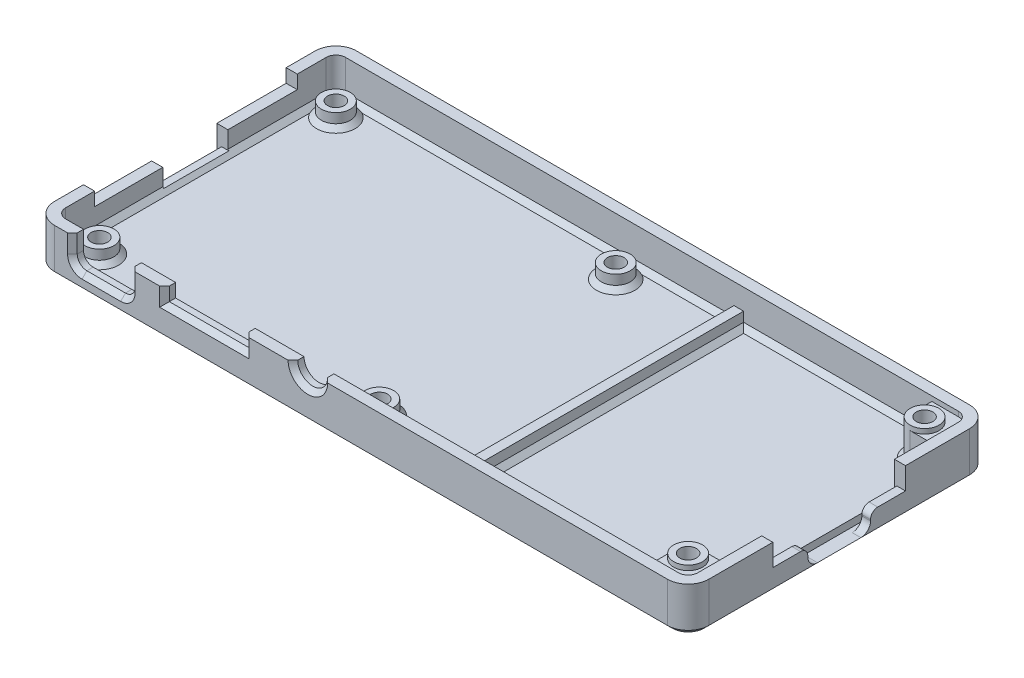
from build123d import *

# Parameters (mm, degrees)
SKETCH3_W                                         = 135.6
SKETCH3_H                                         = 62.6
SKETCH3_W_2                                       = 131
SKETCH3_H_2                                       = 58
BOSS_EXTRUDE1_DEPTH                               = 9.3
SKETCH5_W                                         = 131
SKETCH5_H                                         = 58
BOSS_EXTRUDE2_DEPTH                               = 2
SKETCH6_R                                         = 3
BOSS_EXTRUDE3_DEPTH                               = 3
SKETCH10_W                                        = 2
SKETCH10_H                                        = 58
BOSS_EXTRUDE4_DEPTH                               = 3
CUT_EXTRUDE1_REACH                                = 100.028
SKETCH11_R                                        = 3.1
SKETCH11_W                                        = 12
SKETCH11_H                                        = 5.8
SKETCH11_W_2                                      = 16.5
SKETCH11_H_2                                      = 2.8
CUT_EXTRUDE2_REACH                                = 142.206
SKETCH12_W                                        = 42
SKETCH12_H                                        = 2.8
SKETCH12_W_2                                      = 13.5
SKETCH12_H_2                                      = 3.7
FILLET6_R                                         = 2
FILLET8_R                                         = 2
CHAMFER1_SIZE                                     = 1
BOSS_EXTRUDE7_DEPTH                               = 7.3
FILLET20_R                                        = 4.3
CHAMFER5_SIZE                                     = 1
CSK_FOR_4_FLAT_HEAD_SOCKET_CAP_SCREW1_D           = 3.4544
CSK_FOR_4_FLAT_HEAD_SOCKET_CAP_SCREW1_DEPTH       = 14
CSK_FOR_4_FLAT_HEAD_SOCKET_CAP_SCREW1_CSINK_D     = 6.723761
CSK_FOR_4_FLAT_HEAD_SOCKET_CAP_SCREW1_CSINK_ANGLE = 82
CSK_FOR_4_FLAT_HEAD_SOCKET_CAP_SCREW1_TIP         = 1.037806461
CHAMFER7_SIZE                                     = 1
CHAMFER8_SIZE                                     = 1
CUT_EXTRUDE3_START                                = -1
CUT_EXTRUDE3_DEPTH                                = 1
FILLET21_R                                        = 2
CHAMFER9_SIZE                                     = 1
CUT_EXTRUDE4_DEPTH                                = 0.5
CUT_EXTRUDE4_DEPTH_BACK                           = 0.5
SKETCH30_W                                        = 27.5
SKETCH30_H                                        = 27.5
CUT_EXTRUDE5_DEPTH                                = 139.465527882


with BuildPart() as part:
    # Sketch3 → Boss-Extrude1 (new body)
    with BuildSketch(Plane(origin=(0, 0, 0), x_dir=(1, 0, 0), z_dir=(0, 1, 0))):
        with Locations((-7.061766162, 3.105993834)):
            Rectangle(SKETCH3_W, SKETCH3_H)
        with Locations((-7.061766162, 3.105993834)):
            Rectangle(SKETCH3_W_2, SKETCH3_H_2, mode=Mode.SUBTRACT)
    extrude(amount=BOSS_EXTRUDE1_DEPTH)

    # Sketch5 → Boss-Extrude2 (add)
    with BuildSketch(Plane(origin=(0, 0, 0), x_dir=(1, 0, 0), z_dir=(0, 1, 0))):
        with Locations((-7.061766162, 3.105993834)):
            Rectangle(SKETCH5_W, SKETCH5_H)
    extrude(amount=BOSS_EXTRUDE2_DEPTH)

    # Sketch6 → Boss-Extrude3 (add)
    with BuildSketch(Plane(origin=(0, 2, 0), x_dir=(1, 0, 0), z_dir=(0, 1, 0))):
        with Locations(Location((-68.061766162, 27.605993834, 0), (0, 0, 270))):
            Circle(SKETCH6_R)
        with Locations(Location((-68.061766162, -21.394006166, 0), (0, 0, 270))):
            Circle(SKETCH6_R)
        with Locations(Location((-10.061766162, -21.394006166, 0), (0, 0, 270))):
            Circle(SKETCH6_R)
        with Locations(Location((-10.061766162, 27.605993834, 0), (0, 0, 270))):
            Circle(SKETCH6_R)
    extrude(amount=BOSS_EXTRUDE3_DEPTH)

    # Sketch10 → Boss-Extrude4 (add)
    with BuildSketch(Plane(origin=(0, 2, 0), x_dir=(1, 0, 0), z_dir=(0, 1, 0))):
        with Locations((10.938233838, 3.105993834)):
            Rectangle(SKETCH10_W, SKETCH10_H)
    extrude(amount=BOSS_EXTRUDE4_DEPTH)

    # Sketch11 → Cut-Extrude1 (cut, up to next)
    with BuildSketch(Plane.XY.offset(28.194006166), mode=Mode.PRIVATE) as cut_extrude1_sk1:
        with Locations((-18.061766162, 9.3)):
            Circle(SKETCH11_R)
    cut_extrude1_tool1 = extrude(cut_extrude1_sk1.sketch, amount=-CUT_EXTRUDE1_REACH, mode=Mode.PRIVATE) & part.part
    # Sketch11 → Cut-Extrude1 (cut, up to next)
    with BuildSketch(Plane.XY.offset(28.194006166), mode=Mode.PRIVATE) as cut_extrude1_sk2:
        with Locations((-60.861766162, 6.4)):
            Rectangle(SKETCH11_W, SKETCH11_H)
    cut_extrude1_tool2 = extrude(cut_extrude1_sk2.sketch, amount=-CUT_EXTRUDE1_REACH, mode=Mode.PRIVATE) & part.part
    # Sketch11 → Cut-Extrude1 (cut, up to next)
    with BuildSketch(Plane.XY.offset(28.194006166), mode=Mode.PRIVATE) as cut_extrude1_sk3:
        with Locations((-39.527982648, 7.9)):
            Rectangle(SKETCH11_W_2, SKETCH11_H_2)
    cut_extrude1_tool3 = extrude(cut_extrude1_sk3.sketch, amount=-CUT_EXTRUDE1_REACH, mode=Mode.PRIVATE) & part.part
    add(cut_extrude1_tool1.solids().sort_by_distance((-18.061766, 9.3, 28.194006))[0], mode=Mode.SUBTRACT)
    add(cut_extrude1_tool2.solids().sort_by_distance((-60.861766, 6.4, 28.194006))[0], mode=Mode.SUBTRACT)
    add(cut_extrude1_tool3.solids().sort_by_distance((-39.527983, 7.9, 28.194006))[0], mode=Mode.SUBTRACT)

    # Sketch12 → Cut-Extrude2 (cut, up to next)
    with BuildSketch(Plane.ZY.offset(74.861766162), mode=Mode.PRIVATE) as cut_extrude2_sk1:
        with Locations((-3.105993834, 7.9)):
            Rectangle(SKETCH12_W, SKETCH12_H)
    cut_extrude2_tool1 = extrude(cut_extrude2_sk1.sketch, amount=-CUT_EXTRUDE2_REACH, mode=Mode.PRIVATE) & part.part
    # Sketch12 → Cut-Extrude2 (cut, up to next)
    with BuildSketch(Plane.ZY.offset(74.861766162), mode=Mode.PRIVATE) as cut_extrude2_sk2:
        with Locations((-2.982922372, 4.65)):
            Rectangle(SKETCH12_W_2, SKETCH12_H_2)
    cut_extrude2_tool2 = extrude(cut_extrude2_sk2.sketch, amount=-CUT_EXTRUDE2_REACH, mode=Mode.PRIVATE) & part.part
    add(cut_extrude2_tool1.solids().sort_by_distance((-74.861766, 7.9, -3.105994))[0], mode=Mode.SUBTRACT)
    add(cut_extrude2_tool2.solids().sort_by_distance((-74.861766, 4.65, -2.982922))[0], mode=Mode.SUBTRACT)

    # Fillet6
    fillet6_edges = [part.edges().sort_by_distance(p)[0] for p in [
        (58.438233838, 5.65, -32.105993834),
    ]]
    fillet(fillet6_edges, radius=FILLET6_R)

    # Fillet8
    fillet8_edges = [part.edges().sort_by_distance(p)[0] for p in [
        (-72.561766162, 5.65, -32.105993834),
        (-72.561766162, 5.65, 25.894006166),
    ]]
    fillet(fillet8_edges, radius=FILLET8_R)

    # Chamfer1
    chamfer1_edges = [part.edges().sort_by_distance(p)[0] for p in [
        (-68.061766162, 2, -30.605993834),
        (-68.061766162, 2, 18.394006166),
        (-10.061766162, 2, 18.394006166),
        (-10.061766162, 2, -30.605993834),
    ]]
    chamfer(chamfer1_edges, length=CHAMFER1_SIZE)

    # Sketch24 → Boss-Extrude7 (add)
    with BuildSketch(Plane(origin=(0, 2, 0), x_dir=(1, 0, 0), z_dir=(0, 1, 0))):
        with BuildLine():
            Line((53.938233838, -18.394006166), (58.438233838, -18.394006166))
            Line((58.438233838, -18.394006166), (58.438233838, -25.894006166))
            Line((58.438233838, -25.894006166), (50.938233838, -25.894006166))
            Line((50.938233838, -25.894006166), (50.938233838, -21.394006166))
            ThreePointArc((50.938233838, -21.394006166), (51.816913494, -19.272685822), (53.938233838, -18.394006166))
        make_face()
        with BuildLine():
            Line((50.938233838, 27.605993834), (50.938233838, 32.105993834))
            Line((50.938233838, 32.105993834), (58.438233838, 32.105993834))
            Line((58.438233838, 32.105993834), (58.438233838, 24.605993834))
            Line((58.438233838, 24.605993834), (53.938233838, 24.605993834))
            ThreePointArc((53.938233838, 24.605993834), (51.816913494, 25.484673491), (50.938233838, 27.605993834))
        make_face()
    extrude(amount=BOSS_EXTRUDE7_DEPTH)

    # Fillet20
    fillet20_edges = [part.edges().sort_by_distance(p)[0] for p in [
        (-74.861766162, 4.65, -34.405993834),
        (60.738233838, 4.65, -34.405993834),
        (60.738233838, 4.65, 28.194006166),
        (-74.861766162, 4.65, 28.194006166),
    ]]
    fillet(fillet20_edges, radius=FILLET20_R)

    # Chamfer5
    # the kernel refuses this chamfer: 1 mm, written as the material it adds along each edge
    with BuildSketch(Plane(origin=(-72.561766162, 2, 23.894006166), x_dir=(-0.027495876610568366, 0.9996219169112972, 0), z_dir=(0, 0, -1))) as chamfer5_piece_1_section:
        Polygon((CHAMFER5_SIZE * 0.999621916911, CHAMFER5_SIZE * 0.0274958766106), (-CHAMFER5_SIZE * 0.0274958766106, CHAMFER5_SIZE * 0.999621916911), (0, 0), align=None)
    chamfer5_piece_1 = extrude(amount=54, mode=Mode.PRIVATE)
    chamfer5_piece_1 = split(chamfer5_piece_1, bisect_by=Plane(origin=(-72.495550112, 2.866891976, 3.767077628), z_dir=(0, 0, 1)), keep=Keep.TOP, mode=Mode.PRIVATE)
    add(chamfer5_piece_1)
    with BuildSketch(Plane(origin=(-72.561766162, 2, 23.894006166), x_dir=(-0.027495876610568366, 0.9996219169112972, 0), z_dir=(0, 0, -1))) as chamfer5_piece_2_section:
        Polygon((CHAMFER5_SIZE * 0.999621916911, CHAMFER5_SIZE * 0.0274958766106), (-CHAMFER5_SIZE * 0.0274958766106, CHAMFER5_SIZE * 0.999621916911), (0, 0), align=None)
    chamfer5_piece_2 = extrude(amount=54, mode=Mode.PRIVATE)
    chamfer5_piece_2 = split(chamfer5_piece_2, bisect_by=Plane(origin=(-72.217321718, 2.8, -2.982922372), z_dir=(0, -1, 0)), keep=Keep.TOP, mode=Mode.PRIVATE)
    add(chamfer5_piece_2)
    with BuildSketch(Plane(origin=(-72.561766162, 2, 23.894006166), x_dir=(-0.027495876610568366, 0.9996219169112972, 0), z_dir=(0, 0, -1))) as chamfer5_piece_3_section:
        Polygon((CHAMFER5_SIZE * 0.999621916911, CHAMFER5_SIZE * 0.0274958766106), (-CHAMFER5_SIZE * 0.0274958766106, CHAMFER5_SIZE * 0.999621916911), (0, 0), align=None)
    chamfer5_piece_3 = extrude(amount=54, mode=Mode.PRIVATE)
    chamfer5_piece_3 = split(chamfer5_piece_3, bisect_by=Plane(origin=(-72.495544539, 2.866889189, -9.732922372), z_dir=(0, 0, -1)), keep=Keep.TOP, mode=Mode.PRIVATE)
    add(chamfer5_piece_3)
    with BuildSketch(Plane(origin=(-70.561766162, 2, 23.894006166), x_dir=(0, 0, 1), z_dir=(1, 0, 0))) as chamfer5_piece_4:
        Polygon((2, -CHAMFER5_SIZE), (2 - CHAMFER5_SIZE, 0), (2, 0), align=None)
    revolve(axis=Axis((-70.561766162, 2, 23.894006166), (0, -1, 0)), revolution_arc=90)
    with BuildSketch(Plane(origin=(-70.561766162, 2, -30.105993834), x_dir=(0, 0, -1), z_dir=(1, 0, 0))) as chamfer5_piece_5:
        Polygon((2 - CHAMFER5_SIZE, 0), (2, CHAMFER5_SIZE), (2, 0), align=None)
    revolve(axis=Axis((-70.561766162, 2, -30.105993834), (0, 1, 0)), revolution_arc=90)
    with BuildSketch(Plane(origin=(12.509916826, 2, 25.894006166), x_dir=(0, 0.9996219169112968, 0.027495876610585623), z_dir=(-1, 0, 0))) as chamfer5_piece_6:
        Polygon((CHAMFER5_SIZE * 0.999621916911, CHAMFER5_SIZE * 0.0274958766106), (-CHAMFER5_SIZE * 0.0274958766106, CHAMFER5_SIZE * 0.999621916911), (0, 0), align=None)
    extrude(amount=83.071682988)
    with BuildSketch(Plane(origin=(-70.561766162, 2, -32.105993834), x_dir=(0, -0.027495876610586296, 0.9996219169112968), z_dir=(1, 0, 0))) as chamfer5_piece_7:
        Polygon((CHAMFER5_SIZE * 0.999621916911, -CHAMFER5_SIZE * 0.0274958766106), (-CHAMFER5_SIZE * 0.0274958766106, -CHAMFER5_SIZE * 0.999621916911), (0, 0), align=None)
    extrude(amount=83.071682988)
    with BuildSketch(Plane(origin=(9.938233838, 2, 25.894006166), x_dir=(-0.9996219169112968, -0.027495876610586296, 0), z_dir=(0, 0, -1))) as chamfer5_piece_8:
        Polygon((CHAMFER5_SIZE * 0.999621916911, CHAMFER5_SIZE * 0.0274958766106), (-CHAMFER5_SIZE * 0.0274958766106, CHAMFER5_SIZE * 0.999621916911), (0, 0), align=None)
    extrude(amount=58)
    with BuildSketch(Plane(origin=(11.938233838, 2, -32.105993834), x_dir=(-0.027495876610585623, 0.9996219169112968, 0), z_dir=(0, 0, 1))) as chamfer5_piece_9:
        Polygon((CHAMFER5_SIZE * 0.999621916911, -CHAMFER5_SIZE * 0.0274958766106), (-CHAMFER5_SIZE * 0.0274958766106, -CHAMFER5_SIZE * 0.999621916911), (0, 0), align=None)
    extrude(amount=58)
    with BuildSketch(Plane(origin=(9.36655085, 2, -32.105993834), x_dir=(0, -0.027495876610586296, 0.9996219169112968), z_dir=(1, 0, 0))) as chamfer5_piece_10:
        Polygon((CHAMFER5_SIZE * 0.999621916911, -CHAMFER5_SIZE * 0.0274958766106), (-CHAMFER5_SIZE * 0.0274958766106, -CHAMFER5_SIZE * 0.999621916911), (0, 0), align=None)
    extrude(amount=44.143365976)
    with BuildSketch(Plane(origin=(53.509916826, 2, 25.894006166), x_dir=(0, 0.9996219169112968, 0.027495876610585623), z_dir=(-1, 0, 0))) as chamfer5_piece_11:
        Polygon((CHAMFER5_SIZE * 0.999621916911, CHAMFER5_SIZE * 0.0274958766106), (-CHAMFER5_SIZE * 0.0274958766106, CHAMFER5_SIZE * 0.999621916911), (0, 0), align=None)
    extrude(amount=44.143365976)
    with BuildSketch(Plane(origin=(53.938233838, 2, 21.394006166), x_dir=(-1, 0, 0), z_dir=(0, 0, 1))) as chamfer5_piece_12:
        Polygon((3 + CHAMFER5_SIZE, 0), (3, -CHAMFER5_SIZE), (3, 0), align=None)
    revolve(axis=Axis((53.938233838, 2, 21.394006166), (0, -1, 0)), revolution_arc=90)
    with BuildSketch(Plane(origin=(58.438233838, 2, -27.177676822), x_dir=(-0.9996219169112968, -0.0274958766105862, 0), z_dir=(0, 0, 1))) as chamfer5_piece_13:
        Polygon((CHAMFER5_SIZE * 0.999621916911, -CHAMFER5_SIZE * 0.0274958766106), (-CHAMFER5_SIZE * 0.0274958766106, -CHAMFER5_SIZE * 0.999621916911), (0, 0), align=None)
    extrude(amount=48.143365976)
    with BuildSketch(Plane(origin=(53.938233838, 2, -27.605993834), x_dir=(0, 0, 1), z_dir=(1, 0, 0))) as chamfer5_piece_14:
        Polygon((3 + CHAMFER5_SIZE, 0), (3, -CHAMFER5_SIZE), (3, 0), align=None)
    revolve(axis=Axis((53.938233838, 2, -27.605993834), (0, -1, 0)), revolution_arc=90)
    with BuildSketch(Plane(origin=(50.938233838, 2, 25.894006166), x_dir=(-0.9996219169112968, -0.0274958766105862, 0), z_dir=(0, 0, -1)), Plane(origin=(53.938233838, 2, 18.394006166), x_dir=(0, -0.027495876610586296, -0.9996219169112968), z_dir=(1, 0, 0)), Plane(origin=(58.438233838, 2, -24.605993834), x_dir=(0, -0.027495876610586296, 0.9996219169112968), z_dir=(-1, 0, 0)), Plane(origin=(50.938233838, 2, -27.605993834), x_dir=(-0.9996219169112968, -0.0274958766105862, 0), z_dir=(0, 0, -1))) as chamfer5_piece_15:
        Polygon((CHAMFER5_SIZE * 0.999621916911, CHAMFER5_SIZE * 0.0274958766106), (-CHAMFER5_SIZE * 0.0274958766106, CHAMFER5_SIZE * 0.999621916911), (0, 0), align=None)
    extrude(amount=4.5)

    # CSK for #4 Flat Head Socket Cap Screw1
    with Locations(Plane(origin=(0, 0, 0), x_dir=(-1, 0, 0), z_dir=(0, -1, 0))):
        with Locations((68.061766162, 27.605993834), (68.061766162, -21.394006166), (-53.938233838, 27.605993834), (-53.938233838, -21.394006166), (10.061766162, -21.394006166), (10.061766162, 27.605993834)):
            CounterSinkHole(CSK_FOR_4_FLAT_HEAD_SOCKET_CAP_SCREW1_D / 2, CSK_FOR_4_FLAT_HEAD_SOCKET_CAP_SCREW1_CSINK_D / 2, depth=CSK_FOR_4_FLAT_HEAD_SOCKET_CAP_SCREW1_DEPTH, counter_sink_angle=CSK_FOR_4_FLAT_HEAD_SOCKET_CAP_SCREW1_CSINK_ANGLE)
            with Locations((0, 0, -(CSK_FOR_4_FLAT_HEAD_SOCKET_CAP_SCREW1_DEPTH + CSK_FOR_4_FLAT_HEAD_SOCKET_CAP_SCREW1_TIP / 2))):  # 118° drill point
                Cone(0, CSK_FOR_4_FLAT_HEAD_SOCKET_CAP_SCREW1_D / 2, CSK_FOR_4_FLAT_HEAD_SOCKET_CAP_SCREW1_TIP, mode=Mode.SUBTRACT)

    # Chamfer7
    chamfer7_edges = [part.edges().sort_by_distance(p)[0] for p in [
        (-7.061766162, 0, -34.405993834),
        (-74.861766162, 0, -3.105993834),
        (60.738233838, 0, -3.105993834),
        (-7.061766162, 0, 28.194006166),
        (59.478792997, 0, 26.934565325),
        (-73.602325321, 0, 26.934565325),
        (-73.602325321, 0, -33.146552993),
        (59.478792997, 0, -33.146552993),
    ]]
    chamfer(chamfer7_edges, length=CHAMFER7_SIZE)

    # Chamfer8
    chamfer8_edges = [part.edges().sort_by_distance(p)[0] for p in [
        (-74.861766162, 2.8, -2.982922372),
    ]]
    chamfer(chamfer8_edges, length=CHAMFER8_SIZE)

    # Sketch29 → Cut-Extrude3 (cut)
    with BuildSketch(Plane(origin=(0, 9.3, 0), x_dir=(1, 0, 0), z_dir=(0, 1, 0)).offset(CUT_EXTRUDE3_START)):
        with BuildLine():
            Line((53.938233838, 24.605993834), (58.438233838, 24.605993834))
            Line((58.438233838, 24.605993834), (58.438233838, 30.105993834))
            ThreePointArc((58.438233838, 30.105993834), (57.8524474, 31.520207397), (56.438233838, 32.105993834))
            Line((56.438233838, 32.105993834), (50.938233838, 32.105993834))
            Line((50.938233838, 32.105993834), (50.938233838, 27.605993834))
            ThreePointArc((50.938233838, 27.605993834), (56.059554181, 29.727314178), (53.938233838, 24.605993834))
        make_face()
        with BuildLine():
            Line((53.938233838, -18.394006166), (58.438233838, -18.394006166))
            Line((58.438233838, -18.394006166), (58.438233838, -23.894006166))
            ThreePointArc((58.438233838, -23.894006166), (57.8524474, -25.308219728), (56.438233838, -25.894006166))
            Line((56.438233838, -25.894006166), (50.938233838, -25.894006166))
            Line((50.938233838, -25.894006166), (50.938233838, -21.394006166))
            ThreePointArc((50.938233838, -21.394006166), (56.059554181, -23.515326509), (53.938233838, -18.394006166))
        make_face()
    extrude(amount=CUT_EXTRUDE3_DEPTH, mode=Mode.SUBTRACT)

    # Fillet21
    fillet21_edges = [part.edges().sort_by_distance(p)[0] for p in [
        (-66.861766162, 3.5, 27.044006166),
        (-54.861766162, 3.5, 27.044006166),
    ]]
    fillet(fillet21_edges, radius=FILLET21_R)

    # Chamfer9
    chamfer9_edges = [part.edges().sort_by_distance(p)[0] for p in [
        (-18.061766162, 6.2, 28.194006166),
        (-54.861766162, 7.4, 28.194006166),
        (-60.861766162, 3.5, 28.194006166),
        (-55.4475526, 4.085786438, 28.194006166),
        (-66.275979725, 4.085786438, 28.194006166),
        (-66.861766162, 7.4, 28.194006166),
        (-47.777982648, 7.9, 28.194006166),
        (-39.527982648, 6.5, 28.194006166),
        (-31.277982648, 7.9, 28.194006166),
    ]]
    chamfer(chamfer9_edges, length=CHAMFER9_SIZE)

    # Sketch30 → Cut-Extrude4 (cut, two sides: drawn at the far end of the back side and taken through both)
    with BuildSketch(Plane.ZY.offset(-58.438233838).offset(-CUT_EXTRUDE4_DEPTH_BACK)):
        with Locations((-3.105993834, 14.75)):
            Rectangle(SKETCH30_W, SKETCH30_H)
    extrude(amount=CUT_EXTRUDE4_DEPTH + CUT_EXTRUDE4_DEPTH_BACK, mode=Mode.SUBTRACT)

    # Sketch31 → Cut-Extrude5 (cut, through all)
    with BuildSketch(Plane.ZY.offset(-58.938233838)):
        with BuildLine():
            Line((-16.855993834, 4.75), (-11.105993834, 4.75))
            ThreePointArc((-11.105993834, 4.75), (-10.045333663, 4.310660172), (-9.605993834, 3.25))
            Line((-9.605993834, 3.25), (-9.605993834, 3))
            ThreePointArc((-9.605993834, 3), (-9.020207397, 1.585786438), (-7.605993834, 1))
            Line((-7.605993834, 1), (1.394006166, 1))
            ThreePointArc((1.394006166, 1), (2.808219728, 1.585786438), (3.394006166, 3))
            Line((3.394006166, 3), (3.394006166, 3.25))
            ThreePointArc((3.394006166, 3.25), (3.833345994, 4.310660172), (4.894006166, 4.75))
            Line((4.894006166, 4.75), (10.644006166, 4.75))
            Line((10.644006166, 4.75), (10.644006166, 9.3))
            Line((10.644006166, 9.3), (-16.855993834, 9.3))
            Line((-16.855993834, 9.3), (-16.855993834, 4.75))
        make_face()
    extrude(amount=-CUT_EXTRUDE5_DEPTH, mode=Mode.SUBTRACT)


solid = part.part
